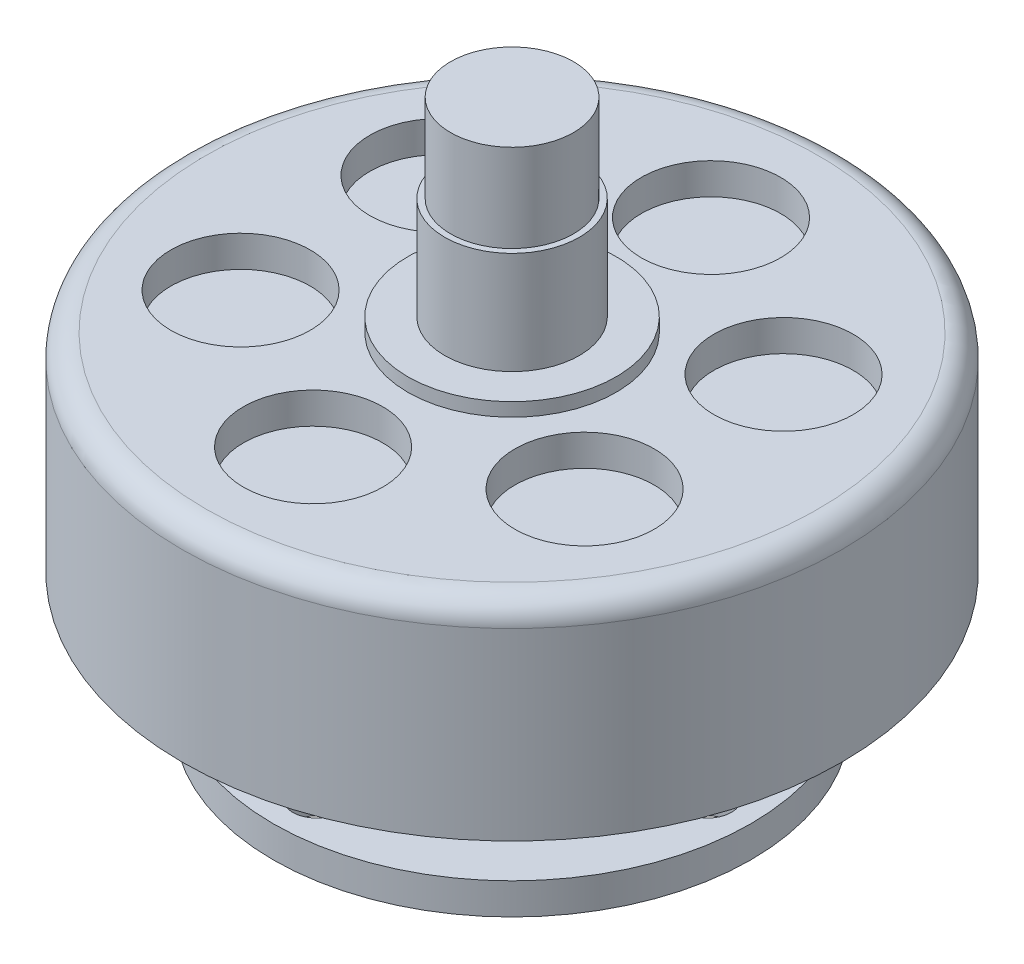
from build123d import *

# Parameters (mm, degrees)
CROQUIS1_R              = 21.05
SALIENTE_EXTRUIR1_DEPTH = 13.25
REDONDEO1_R             = 1.5
CROQUIS2_R              = 4.45
CORTAR_EXTRUIR1_DEPTH   = 2
CROQUIS3_R              = 3.925
SALIENTE_EXTRUIR2_DEPTH = 13
CROQUIS4_R              = 5.908652193
SALIENTE_EXTRUIR3_DEPTH = 6.3
CROQUIS5_R              = 15.25
CROQUIS5_R_2            = 1.5
SALIENTE_EXTRUIR4_DEPTH = 2
CROQUIS6_R              = 2
SALIENTE_EXTRUIR5_DEPTH = 2.7
CROQUIS7_R              = 3
SALIENTE_EXTRUIR6_DEPTH = 1.2
CROQUIS8_W              = 3.5
CROQUIS8_H              = 3.439508105
SALIENTE_EXTRUIR7_DEPTH = 0.2
CROQUIS9_R              = 4.3
SALIENTE_EXTRUIR8_DEPTH = 7.4
CROQUIS10_R             = 6.65
SALIENTE_EXTRUIR9_DEPTH = 0.86


with BuildPart() as part:
    # Croquis1 → Saliente-Extruir1 (new body)
    with BuildSketch(Plane(origin=(0, 0, 0), x_dir=(1, 0, 0), z_dir=(0, 1, 0))):
        Circle(CROQUIS1_R)
    extrude(amount=SALIENTE_EXTRUIR1_DEPTH)

    # Redondeo1
    redondeo1_edges = [part.edges().sort_by_distance(p)[0] for p in [
        (-21.05, 13.25, 0),
    ]]
    fillet(redondeo1_edges, radius=REDONDEO1_R)

    # Croquis2 → Cortar-Extruir1 (cut)
    with BuildSketch(Plane(origin=(0, 13.25, 0), x_dir=(1, 0, 0), z_dir=(0, 1, 0))):
        with Locations((0.010957244, 12.691225968)):
            Circle(CROQUIS2_R)
        with Locations((10.996402716, 6.336123732)):
            Circle(CROQUIS2_R)
        with Locations((10.985445471, -6.355102236)):
            Circle(CROQUIS2_R)
        with Locations((-0.010957244, -12.691225968)):
            Circle(CROQUIS2_R)
        with Locations((-10.996402716, -6.336123732)):
            Circle(CROQUIS2_R)
        with Locations((-10.985445471, 6.355102236)):
            Circle(CROQUIS2_R)
    extrude(amount=-CORTAR_EXTRUIR1_DEPTH, mode=Mode.SUBTRACT)

    # Croquis3 → Saliente-Extruir2 (add)
    with BuildSketch(Plane(origin=(0, 13.25, 0), x_dir=(1, 0, 0), z_dir=(0, 1, 0))):
        Circle(CROQUIS3_R)
    extrude(amount=SALIENTE_EXTRUIR2_DEPTH)

    # Croquis4 → Saliente-Extruir3 (add)
    with BuildSketch(Plane.XZ):
        Circle(CROQUIS4_R)
    extrude(amount=SALIENTE_EXTRUIR3_DEPTH)

    # Croquis5 → Saliente-Extruir4 (add)
    with BuildSketch(Plane.XZ.offset(6.3)):
        Circle(CROQUIS5_R)
        with Locations((0, 12.5)):
            Circle(CROQUIS5_R_2, mode=Mode.SUBTRACT)
        with Locations((12.5, 0)):
            Circle(CROQUIS5_R_2, mode=Mode.SUBTRACT)
        with Locations((0, -12.5)):
            Circle(CROQUIS5_R_2, mode=Mode.SUBTRACT)
        with Locations((-12.5, 0)):
            Circle(CROQUIS5_R_2, mode=Mode.SUBTRACT)
    extrude(amount=SALIENTE_EXTRUIR4_DEPTH)

    # Croquis6 → Saliente-Extruir5 (add)
    with BuildSketch(Plane.XZ.offset(8.3)):
        Circle(CROQUIS6_R)
    extrude(amount=SALIENTE_EXTRUIR5_DEPTH)

    # Croquis7 → Saliente-Extruir6 (add)
    with BuildSketch(Plane.XZ.offset(8.3)):
        Circle(CROQUIS7_R)
    extrude(amount=SALIENTE_EXTRUIR6_DEPTH)

    # Croquis8 → Saliente-Extruir7 (add)
    with BuildSketch(Plane.XZ.offset(9.5)):
        with Locations((0, 1.730245948)):
            Rectangle(CROQUIS8_W, CROQUIS8_H)
    extrude(amount=SALIENTE_EXTRUIR7_DEPTH)

    # Croquis9 → Saliente-Extruir8 (add)
    with BuildSketch(Plane(origin=(0, 13.25, 0), x_dir=(1, 0, 0), z_dir=(0, 1, 0))):
        Circle(CROQUIS9_R)
    extrude(amount=SALIENTE_EXTRUIR8_DEPTH)

    # Croquis10 → Saliente-Extruir9 (add)
    with BuildSketch(Plane(origin=(0, 13.25, 0), x_dir=(1, 0, 0), z_dir=(0, 1, 0))):
        Circle(CROQUIS10_R)
    extrude(amount=SALIENTE_EXTRUIR9_DEPTH)


solid = part.part
